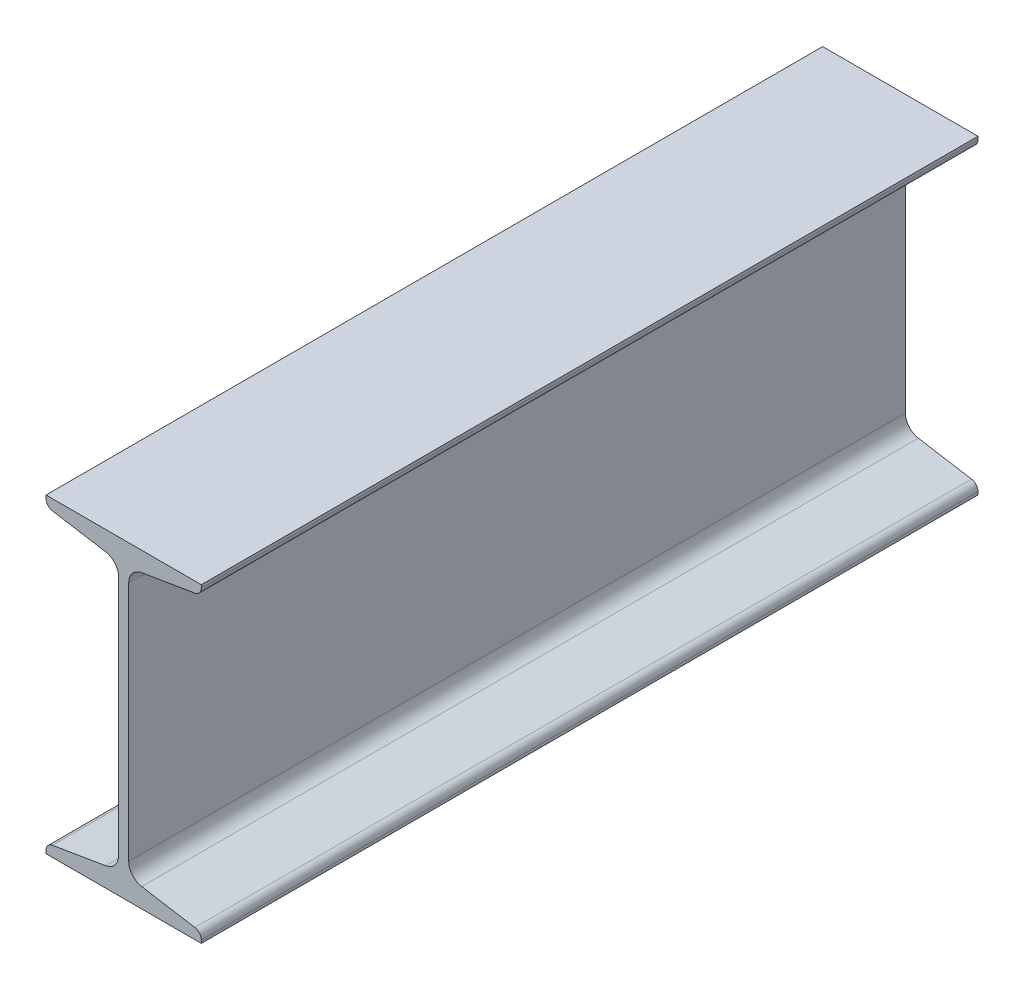
from build123d import *

# Parameters (mm, degrees)
BASESBEAM_START = -300
BASESBEAM_DEPTH = 600
TOEFILLET_R     = 6


# Read off the part's stored shape, not the designer's step: BaseSbeam
with BuildPart() as part:
    # BaseSbeam outline → BaseSbeam (new body)
    with BuildSketch(Plane.XY.offset(BASESBEAM_START)):
        with BuildLine():
            Line((0, 7.324658955), (0, 0))
            Line((0, 0), (120, 0))
            Line((120, 0), (120, 7.324658955))
            Line((120, 7.324658955), (73.927072128, 15.004040437))
            ThreePointArc((73.927072128, 15.004040437), (66.743714332, 19.084299589), (63.9, 26.840744185))
            Line((63.9, 26.840744185), (63.9, 213.159255815))
            ThreePointArc((63.9, 213.159255815), (66.743714332, 220.915700411), (73.927072128, 224.995959563))
            Line((73.927072128, 224.995959563), (120, 232.675341045))
            Line((120, 232.675341045), (120, 240))
            Line((120, 240), (0, 240))
            Line((0, 240), (0, 232.675341045))
            Line((0, 232.675341045), (46.072927872, 224.995959563))
            ThreePointArc((46.072927872, 224.995959563), (53.256285668, 220.915700411), (56.1, 213.159255815))
            Line((56.1, 213.159255815), (56.1, 26.840744185))
            ThreePointArc((56.1, 26.840744185), (53.256285668, 19.084299589), (46.072927872, 15.004040437))
            Line((46.072927872, 15.004040437), (0, 7.324658955))
        make_face()
    extrude(amount=BASESBEAM_DEPTH)

    # ToeFillet
    toefillet_edges = [part.edges().sort_by_distance(p)[0] for p in [
        (120, 7.324658955, 0),
        (120, 232.675341045, 0),
        (0, 232.675341045, 0),
        (0, 7.324658955, 0),
    ]]
    fillet(toefillet_edges, radius=TOEFILLET_R)


solid = part.part
